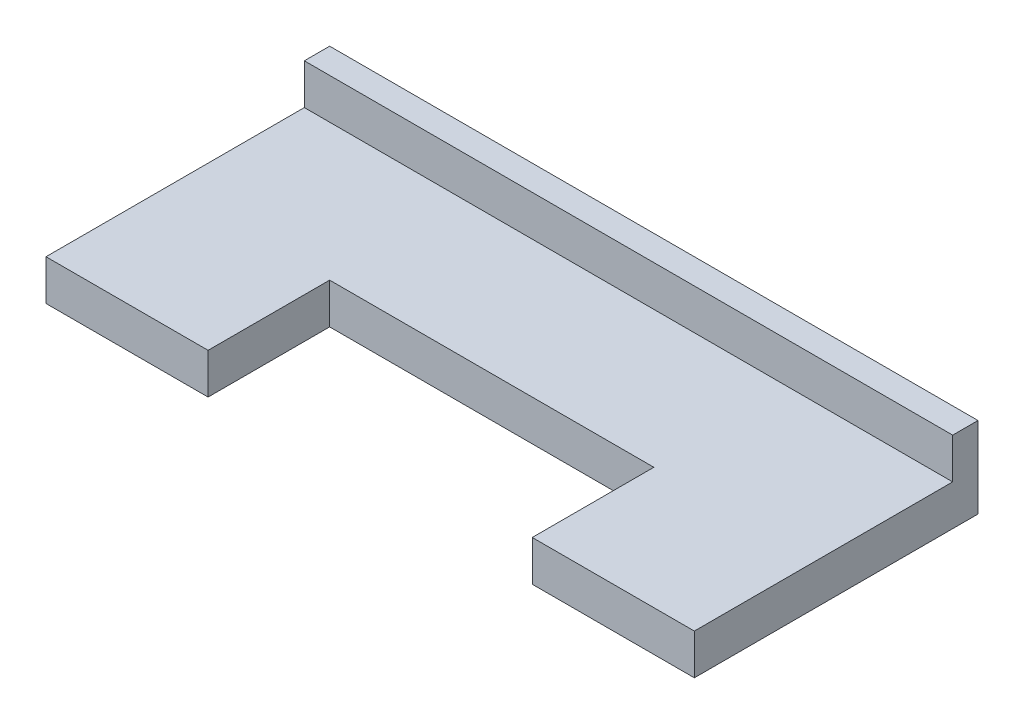
from build123d import *

# Parameters (mm, degrees)
SKETCH1_W           = 20.32
SKETCH1_H           = 10.16
BOSS_EXTRUDE1_DEPTH = 1.27
SKETCH2_W           = 10.16
SKETCH2_H           = 5.08
CUT_EXTRUDE1_DEPTH  = 12.43
SKETCH4_W           = 20.32
SKETCH4_H           = 0.79375
BOSS_EXTRUDE2_DEPTH = 1.27
SKETCH5_W           = 5.08
SKETCH5_H           = 1.27
CUT_EXTRUDE2_DEPTH  = 1.27


with BuildPart() as part:
    # Sketch1 → Boss-Extrude1 (new body)
    with BuildSketch(Plane(origin=(0, 0, 0), x_dir=(1, 0, 0), z_dir=(0, 1, 0))):
        Rectangle(SKETCH1_W, SKETCH1_H)
    extrude(amount=BOSS_EXTRUDE1_DEPTH)

    # Sketch2 → Cut-Extrude1 (cut, through all)
    with BuildSketch(Plane(origin=(0, 1.27, 0), x_dir=(1, 0, 0), z_dir=(0, 1, 0))):
        with Locations((0, -2.54)):
            Rectangle(SKETCH2_W, SKETCH2_H)
    extrude(amount=-CUT_EXTRUDE1_DEPTH, mode=Mode.SUBTRACT)

    # Sketch4 → Boss-Extrude2 (add)
    with BuildSketch(Plane(origin=(0, 1.27, 0), x_dir=(1, 0, 0), z_dir=(0, 1, 0))):
        with Locations((0, 4.683125)):
            Rectangle(SKETCH4_W, SKETCH4_H)
    extrude(amount=BOSS_EXTRUDE2_DEPTH)

    # Sketch5 → Cut-Extrude2 (cut)
    with BuildSketch(Plane.XY.offset(5.08)):
        with Locations((7.62, 0.635)):
            Rectangle(SKETCH5_W, SKETCH5_H)
        with Locations((-7.62, 0.635)):
            Rectangle(SKETCH5_W, SKETCH5_H)
    extrude(amount=-CUT_EXTRUDE2_DEPTH, mode=Mode.SUBTRACT)


solid = part.part
